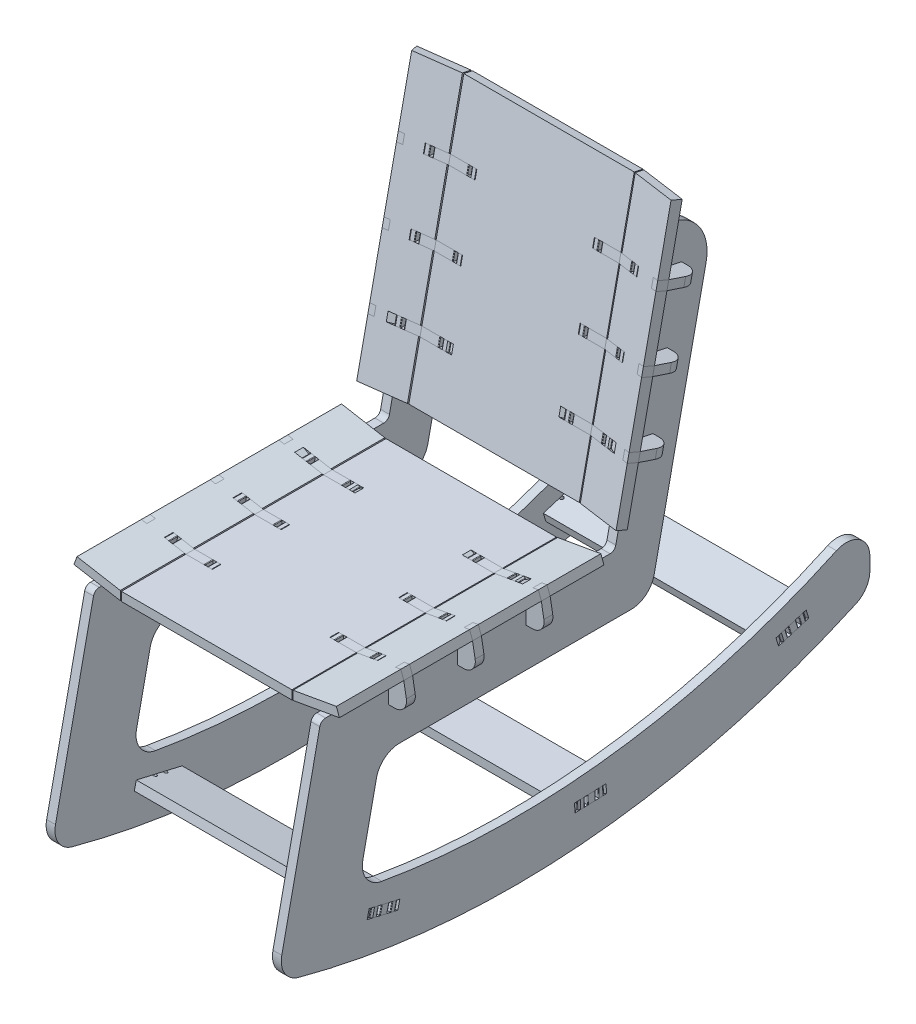
from build123d import *
from OCP.BRepFilletAPI import BRepFilletAPI_MakeChamfer

# Parameters (mm, degrees)
SKETCH1_W                      = 145
SKETCH1_H                      = 450
CENTRO_ASIENTO_DEPTH           = 15
LATERAL_ASIENTO_DEPTH          = 450
HUECO_START                    = -7.4
HUECO_JUNTA_OUTLINE_W          = 45
HUECO_JUNTA_OUTLINE_H          = 15
HUECO_JUNTA_DEPTH              = 14.8
BASE_START                     = -133.5
BASE_DE_ASIENTO_DEPTH          = 15
CHAMFER2_SIZE                  = 5
CHAMFER2_SIZE2                 = 8.660254038
CHAMFER3_SIZE                  = 5
CHAMFER3_SIZE2                 = 12.660444431
FILLET1_R                      = 20
PATRON_DE_HUECO_COUNT          = 3
PATRON_DE_HUECO_PITCH          = 117
PATRON_DE_BASES_COUNT          = 3
PATRON_DE_BASES_PITCH          = 117
SKETCH7_W                      = 14.8
SKETCH7_H                      = 15
HUECO_DE_JUNTA_DE_LATERA_DEPTH = 324.899019324
LATERAL_DEPTH                  = 15
BOSS_EXTRUDE8_DEPTH            = 185
BOSS_EXTRUDE9_DEPTH            = 15
CUT_EXTRUDE4_DEPTH             = 15
BOSS_EXTRUDE10_DEPTH           = 15
CUT_EXTRUDE5_DEPTH             = 15
CHAMFER4_SIZE                  = 5
CHAMFER4_SIZE2                 = 8.660254038
CIRPATTERN1_COUNT              = 3
CIRPATTERN1_ANGLE              = 30
CHAMFER4_OF_CIRPATTERN1_SIZE   = 5
CHAMFER4_OF_CIRPATTERN1_SIZE2  = 8.660254038
CIRPATTERN2_COUNT              = 3
CIRPATTERN2_ANGLE              = 30
MIRROR15_START                 = -427.113890753
MIRROR15_DEPTH                 = 14.96
MIRROR15_START_2               = -358.474090932
MIRROR15_2_DEPTH               = 14.96
MIRROR15_START_3               = -358.859222222
MIRROR15_3_DEPTH               = 14.96


# Read off the part's stored shape, not the designer's step: hueco junta, base de asiento, Mirror15
with BuildPart() as part:
    # Sketch1 → centro asiento (new body)
    with BuildSketch(Plane(origin=(0, 0, 0), x_dir=(1, 0, 0), z_dir=(0, 1, 0))):
        with Locations((72.5, 0)):
            Rectangle(SKETCH1_W, SKETCH1_H)
    extrude(amount=CENTRO_ASIENTO_DEPTH)


with BuildPart() as body_2:
    # Sketch2 → lateral asiento (new body)
    with BuildSketch(Plane.XY.offset(225)):
        Polygon((147, 0.352653961), (147, 15.352653961), (220.654318091, 28.339897487), (225.784620241, 14.244508175), align=None)
    extrude(amount=-LATERAL_ASIENTO_DEPTH)


with BuildPart() as hueco_junta_tool:
    # hueco junta outline → hueco junta (new body)
    with BuildSketch(Plane(origin=(0, 0, -126), x_dir=(-1, 0, 0), z_dir=(0, 0, -1)).offset(HUECO_START)):
        Polygon((-211.595504869, 11.742584302), (-211.595504869, 26.742584302), (-220.654318091, 28.339897487), (-225.784620241, 14.244508175), align=None)
        Polygon((-147, 15.352653961), (-181.468271355, 21.43034018), (-181.468271355, 6.43034018), (-147, 0.352653961), align=None)
        with Locations((-122.5, 7.5)):
            Rectangle(HUECO_JUNTA_OUTLINE_W, HUECO_JUNTA_OUTLINE_H)
    hueco_junta = extrude(amount=HUECO_JUNTA_DEPTH)


with BuildPart() as part_1:
    add(part.part)

    # hueco junta: cut by hueco_junta_tool
    add(hueco_junta_tool.part, mode=Mode.SUBTRACT)

    # Chamfer2
    chamfer2_edges = [part_1.edges().sort_by_distance(p)[0] for p in [
        (100, 15, -126),
    ]]
    chamfer2_side = [part_1.faces().sort_by_distance(p)[0] for p in [
        (100, 7.5, -126),
    ]]
    chamfer(chamfer2_edges, length=CHAMFER2_SIZE, length2=CHAMFER2_SIZE2, reference=chamfer2_side[0])


with BuildPart() as body_2_1:
    add(body_2.part)

    # hueco junta: cut by hueco_junta_tool
    add(hueco_junta_tool.part, mode=Mode.SUBTRACT)

    # Chamfer3
    chamfer3_edges = [body_2_1.edges().sort_by_distance(p)[0] for p in [
        (181.468271355, 21.43034018, -126),
    ]]
    chamfer3_side = [body_2_1.faces().sort_by_distance(p)[0] for p in [
        (181.468271355, 13.93034018, -126),
    ]]
    chamfer(chamfer3_edges, length=CHAMFER3_SIZE, length2=CHAMFER3_SIZE2, reference=chamfer3_side[0])


with BuildPart() as body_3:
    # base de asiento outline → base de asiento (new body)
    with BuildSketch(Plane.XY.offset(BASE_START)):
        with BuildLine():
            Line((167.325796529, 18.919386805), (167.258844549, 18.924834853))
            Line((167.258844549, 18.924834853), (145, 15))
            Line((145, 15), (114.5, 15))
            ThreePointArc((114.5, 15), (113.792893219, 14.707106781), (113.5, 14))
            Line((113.5, 14), (113.5, -2.304273175))
            ThreePointArc((113.5, -2.304273175), (110.75, -5.054273175), (108, -2.304273175))
            Line((108, -2.304273175), (108, 14))
            ThreePointArc((108, 14), (107.707106781, 14.707106781), (107, 15))
            Line((107, 15), (101, 15))
            Line((101, 15), (98.291144292, 13.138478673))
            ThreePointArc((98.291144292, 13.138478673), (97.858274182, 12.275088925), (98.357504319, 11.448295324))
            Line((98.357504319, 11.448295324), (100, 10.5))
            Line((100, 10.5), (100, 0))
            Line((100, 0), (0, 0))
            Line((0, 0), (0, -34.130131105))
            Line((0, -34.130131105), (234.314374328, -34.130131105))
            Line((234.314374328, -34.130131105), (225.784620241, 14.244508175))
            Line((225.784620241, 14.244508175), (220.654318091, 28.339897487))
            Line((220.654318091, 28.339897487), (211.595504869, 26.742584302))
            Line((211.595504869, 26.742584302), (211.595504869, 11.742584302))
            Line((211.595504869, 11.742584302), (181.468271355, 6.43034018))
            Line((181.468271355, 6.43034018), (181.468271355, 16.93034018))
            Line((181.468271355, 16.93034018), (183.110767037, 17.878635503))
            ThreePointArc((183.110767037, 17.878635503), (183.609997173, 18.705429105), (183.177127064, 19.568818853))
            Line((183.177127064, 19.568818853), (180.672465677, 21.290018167))
            Line((180.672465677, 21.290018167), (174.583259993, 20.216326914))
            ThreePointArc((174.583259993, 20.216326914), (173.937756127, 19.805095597), (173.772100418, 19.057870983))
            Line((173.772100418, 19.057870983), (176.604840036, 2.992606288))
            ThreePointArc((176.604840036, 2.992606288), (174.374151204, -0.193147522), (171.188397394, 2.037541311))
            Line((171.188397394, 2.037541311), (168.357190069, 18.09411594))
            ThreePointArc((168.357190069, 18.09411594), (167.997148557, 18.701283658), (167.325796529, 18.919386805))
        make_face()
    extrude(amount=BASE_DE_ASIENTO_DEPTH)

    # Fillet1
    fillet1_edges = [body_3.edges().sort_by_distance(p)[0] for p in [
        (234.314374328, -34.130131105, -126),
    ]]
    fillet(fillet1_edges, radius=FILLET1_R)

    # base de asiento mirror: body 3 across plane


with BuildPart() as body_3_1:
    add(body_3.part)
    add(body_3.part.mirror(Plane(origin=(0, 0, -118.5), x_dir=(0, 0, 1), z_dir=(1, 0, 0))))


with BuildPart() as patron_de_hueco_tool:
    # patron de hueco: hueco junta ×3
    with Locations(*[(0, 0, i * PATRON_DE_HUECO_PITCH) for i in range(1, PATRON_DE_HUECO_COUNT)]):
        add(hueco_junta)


with BuildPart() as part_2:
    add(part_1.part)

    # patron de hueco: cut by patron_de_hueco_tool
    add(patron_de_hueco_tool.part, mode=Mode.SUBTRACT)

    # Mirror8: part across plane


with BuildPart() as body_2_2:
    add(body_2_1.part)

    # patron de hueco: cut by patron_de_hueco_tool
    add(patron_de_hueco_tool.part, mode=Mode.SUBTRACT)


with BuildPart() as patron_de_bases_1:
    # patron de bases: pattern copy
    add(body_3_1.part.moved(Location(Vector(0, 0, 1) * (1 * PATRON_DE_BASES_PITCH))))


with BuildPart() as patron_de_bases_2:
    # patron de bases: pattern copy
    add(body_3_1.part.moved(Location(Vector(0, 0, 1) * (2 * PATRON_DE_BASES_PITCH))))


with BuildPart() as part_3:
    add(part_2.part)
    add(part_2.part.mirror(Plane(origin=(0, 15, 0), x_dir=(0, 0, 1), z_dir=(1, 0, 0))))


with BuildPart() as body_6:
    # lateral assiento mirror: mirrored copy
    add(body_2_2.part.mirror(Plane(origin=(0, 0, 0), x_dir=(0, 0, 1), z_dir=(1, 0, 0))))


with BuildPart() as hueco_de_junta_de_latera_tool:
    # Sketch7 → hueco de junta de latera (new, symmetric)
    with BuildSketch(Plane.XY):
        with Locations((192.6, -26.630131105)):
            Rectangle(SKETCH7_W, SKETCH7_H)
    hueco_de_junta_de_latera = extrude(amount=HUECO_DE_JUNTA_DE_LATERA_DEPTH, both=True)


with BuildPart() as body_3_2:
    add(body_3_1.part)

    # hueco de junta de latera: cut by hueco_de_junta_de_latera_tool
    add(hueco_de_junta_de_latera_tool.part, mode=Mode.SUBTRACT)


with BuildPart() as patron_de_bases_1_1:
    add(patron_de_bases_1.part)

    # hueco de junta de latera: cut by hueco_de_junta_de_latera_tool
    add(hueco_de_junta_de_latera_tool.part, mode=Mode.SUBTRACT)


with BuildPart() as patron_de_bases_2_1:
    add(patron_de_bases_2.part)

    # hueco de junta de latera: cut by hueco_de_junta_de_latera_tool
    add(hueco_de_junta_de_latera_tool.part, mode=Mode.SUBTRACT)


with BuildPart() as junta_de_lateral_mirror_tool:
    # junta de lateral mirror: hueco de junta de latera across plane
    add(hueco_de_junta_de_latera.mirror(Plane(origin=(0, 0, 0), x_dir=(0, 0, 1), z_dir=(1, 0, 0))))


with BuildPart() as body_3_3:
    add(body_3_2.part)

    # junta de lateral mirror: cut by junta_de_lateral_mirror_tool
    add(junta_de_lateral_mirror_tool.part, mode=Mode.SUBTRACT)


with BuildPart() as patron_de_bases_1_2:
    add(patron_de_bases_1_1.part)

    # junta de lateral mirror: cut by junta_de_lateral_mirror_tool
    add(junta_de_lateral_mirror_tool.part, mode=Mode.SUBTRACT)


with BuildPart() as patron_de_bases_2_2:
    add(patron_de_bases_2_1.part)

    # junta de lateral mirror: cut by junta_de_lateral_mirror_tool
    add(junta_de_lateral_mirror_tool.part, mode=Mode.SUBTRACT)


with BuildPart() as body_7:
    # espaldar mirror: mirrored copy
    add(part_3.part.mirror(Plane(origin=(0, 131.715277178, -162.654821259), x_dir=(0, 0.7771459614569677, 0.6293203910498414), z_dir=(0, -0.6293203910498414, 0.7771459614569677))))


with BuildPart() as body_8:
    # espaldar mirror 2: mirrored copy
    add(body_2_2.part.mirror(Plane(origin=(0, 131.715277178, -162.654821259), x_dir=(0, 0.7771459614569677, 0.6293203910498414), z_dir=(0, -0.6293203910498414, 0.7771459614569677))))


with BuildPart() as body_9:
    # espaldar mirror 3: mirrored copy
    add(body_3_3.part.mirror(Plane(origin=(0, 131.715277178, -162.654821259), x_dir=(0, 0.7771459614569677, 0.6293203910498414), z_dir=(0, -0.6293203910498414, 0.7771459614569677))))


with BuildPart() as body_10:
    # espaldar mirror 4: mirrored copy
    add(patron_de_bases_1_2.part.mirror(Plane(origin=(0, 131.715277178, -162.654821259), x_dir=(0, 0.7771459614569677, 0.6293203910498414), z_dir=(0, -0.6293203910498414, 0.7771459614569677))))


with BuildPart() as body_11:
    # espaldar mirror 5: mirrored copy
    add(patron_de_bases_2_2.part.mirror(Plane(origin=(0, 131.715277178, -162.654821259), x_dir=(0, 0.7771459614569677, 0.6293203910498414), z_dir=(0, -0.6293203910498414, 0.7771459614569677))))


with BuildPart() as body_12:
    # espaldar mirror 6: mirrored copy
    add(body_6.part.mirror(Plane(origin=(0, 131.715277178, -162.654821259), x_dir=(0, 0.7771459614569677, 0.6293203910498414), z_dir=(0, -0.6293203910498414, 0.7771459614569677))))


with BuildPart() as body_13:
    # Sketch9 → lateral (new body)
    with BuildSketch(Plane(origin=(200, 0, 0), x_dir=(0, 0, -1), z_dir=(1, 0, 0))):
        with BuildLine():
            Line((133.4, -0.2), (133.4, -19.130131105))
            Line((133.4, -19.130131105), (118.6, -19.130131105))
            Line((118.6, -19.130131105), (118.6, -0.2))
            Line((118.6, -0.2), (16.4, -0.2))
            Line((16.4, -0.2), (16.4, -19.130131105))
            Line((16.4, -19.130131105), (1.6, -19.130131105))
            Line((1.6, -19.130131105), (1.6, -0.2))
            Line((1.6, -0.2), (-100.5, -0.2))
            Line((-100.5, -0.2), (-100.5, -19.130131105))
            Line((-100.5, -19.130131105), (-115.5, -19.130131105))
            Line((-115.5, -19.130131105), (-115.5, -0.2))
            Line((-115.5, -0.2), (-222.7169222, -0.2))
            ThreePointArc((-222.7169222, -0.2), (-229.01012611, -2.428540385), (-232.498398207, -8.120883092))
            Line((-232.498398207, -8.120883092), (-297.208407351, -312.557540494))
            ThreePointArc((-297.208407351, -312.557540494), (-292.212377636, -341.734297658), (-268.525048202, -359.486872))
            ThreePointArc((-268.525048202, -359.486872), (212.21172433, -403.766433707), (679.650786777, -283.063298085))
            ThreePointArc((679.650786777, -283.063298085), (696.771873684, -268.304545688), (703.158778549, -246.621376283))
            Line((703.158778549, -246.621376283), (703.158778549, -224.635184402))
            ThreePointArc((703.158778549, -224.635184402), (684.728815484, -190.949378688), (646.422103218, -188.30498073))
            ThreePointArc((646.422103218, -188.30498073), (267.318131938, -297.45486779), (-127.087018515, -288.617663345))
            ThreePointArc((-127.087018515, -288.617663345), (-153.324093764, -271.600422628), (-159.297021384, -240.903603005))
            Line((-159.297021384, -240.903603005), (-136.124090017, -131.883532367))
            ThreePointArc((-136.124090017, -131.883532367), (-122.171001629, -109.114161542), (-96.998185987, -100.2))
            Line((-96.998185987, -100.2), (297.052935967, -100.2))
            ThreePointArc((297.052935967, -100.2), (322.225751609, -91.285838458), (336.178839996, -68.516467633))
            Line((336.178839996, -68.516467633), (424.586342239, 347.408129322))
            ThreePointArc((424.586342239, 347.408129322), (414.12556478, 403.84943376), (366.818648995, 436.362576188))
            Line((366.818648995, 436.362576188), (362.272858618, 437.328813761))
            Line((362.272858618, 437.328813761), (349.302651638, 376.30878748))
            Line((349.302651638, 376.30878748), (368.01474348, 372.331409576))
            Line((368.01474348, 372.331409576), (364.937650456, 357.854825086))
            Line((364.937650456, 357.854825086), (346.225558614, 361.832202989))
            Line((346.225558614, 361.832202989), (324.976983813, 261.865518194))
            Line((324.976983813, 261.865518194), (343.689075654, 257.888140291))
            Line((343.689075654, 257.888140291), (340.61198263, 243.4115558))
            Line((340.61198263, 243.4115558), (321.899890788, 247.388933703))
            Line((321.899890788, 247.388933703), (300.651315987, 147.422248908))
            Line((300.651315987, 147.422248908), (319.363407829, 143.444871005))
            Line((319.363407829, 143.444871005), (316.286314805, 128.968286514))
            Line((316.286314805, 128.968286514), (297.574222963, 132.945664417))
            Line((297.574222963, 132.945664417), (270.956874008, 7.720883092))
            ThreePointArc((270.956874008, 7.720883092), (267.468601911, 2.028540385), (261.175398001, -0.2))
            Line((261.175398001, -0.2), (133.4, -0.2))
        make_face()
    extrude(amount=-LATERAL_DEPTH)


with BuildPart() as body_14:
    # lateral 2: mirrored copy
    add(body_13.part.mirror(Plane(origin=(0, 0, 0), x_dir=(0, 0, 1), z_dir=(1, 0, 0))))

    # Sketch15 → Cut-Extrude5 (cut)
    with BuildSketch(Plane(origin=(-185, 0, 0), x_dir=(0, 0, -1), z_dir=(1, 0, 0))):
        Polygon((-140.181102848, -320.099438691), (-101.257166732, -329.139836757), (-104.641660101, -343.711960989), (-143.565596218, -334.671562923), align=None)
    cut_extrude5 = extrude(amount=-CUT_EXTRUDE5_DEPTH, mode=Mode.SUBTRACT)

    # Chamfer4: one chamfer whose edges measure the first distance from different faces: ONE call of the kernel's chamfer builder (chamfer() names one face for all edges)
    chamfer4_edges_1 = [body_14.edges().sort_by_distance(p)[0] for p in [
        (-200, -336.425898873, 102.949413417),
    ]]
    chamfer4_side_1 = [body_14.faces().sort_by_distance(p)[0] for p in [
        (-200, 232.58090146, -328.531101177),
    ]]
    chamfer4_edges_2 = [body_14.edges().sort_by_distance(p)[0] for p in [
        (-200, -327.385500807, 141.873349533),
    ]]
    chamfer4_side_2 = [body_14.faces().sort_by_distance(p)[0] for p in [
        (-192.5, -327.385500807, 141.873349533),
    ]]
    chamfer4 = BRepFilletAPI_MakeChamfer(body_14.part.solid().wrapped)
    for e in chamfer4_edges_1:
        chamfer4.Add(CHAMFER4_SIZE, CHAMFER4_SIZE2, e.wrapped, chamfer4_side_1[0].wrapped)  # the first distance lies on this face
    for e in chamfer4_edges_2:
        chamfer4.Add(CHAMFER4_SIZE, CHAMFER4_SIZE2, e.wrapped, chamfer4_side_2[0].wrapped)  # the first distance lies on this face
    add(Compound.cast(chamfer4.Shape()), mode=Mode.REPLACE)

    # CirPattern1: Cut-Extrude5 ×3 about axis
    cirpattern1_axis = Axis((0, 999.8, -99.083379214), (1, 0, 0))
    for i in range(1, CIRPATTERN1_COUNT):
        add(cut_extrude5.rotate(cirpattern1_axis, i * CIRPATTERN1_ANGLE / (CIRPATTERN1_COUNT - 1)), mode=Mode.SUBTRACT)

    # Chamfer4 of CirPattern1: one chamfer whose edges measure the first distance from different faces: ONE call of the kernel's chamfer builder (chamfer() names one face for all edges)
    chamfer4_of_cirpattern1_edges_1 = [body_14.edges().sort_by_distance(p)[0] for p in [
        (-200, -343.185039946, -249.775398243),
    ]]
    chamfer4_of_cirpattern1_side_1 = [body_14.faces().sort_by_distance(p)[0] for p in [
        (-200, 318.108698597, -519.283774109),
    ]]
    chamfer4_of_cirpattern1_edges_2 = [body_14.edges().sort_by_distance(p)[0] for p in [
        (-200, -344.526941952, -209.837935892),
    ]]
    chamfer4_of_cirpattern1_side_2 = [body_14.faces().sort_by_distance(p)[0] for p in [
        (-192.5, -344.526941952, -209.837935892),
    ]]
    chamfer4_of_cirpattern1_edges_3 = [body_14.edges().sort_by_distance(p)[0] for p in [
        (-200, -258.421969934, -592.230797835),
    ]]
    chamfer4_of_cirpattern1_side_3 = [body_14.faces().sort_by_distance(p)[0] for p in [
        (-200, 450.092631377, -681.400484544),
    ]]
    chamfer4_of_cirpattern1_edges_4 = [body_14.edges().sort_by_distance(p)[0] for p in [
        (-200, -270.054723607, -554.00148131),
    ]]
    chamfer4_of_cirpattern1_side_4 = [body_14.faces().sort_by_distance(p)[0] for p in [
        (-192.5, -270.054723607, -554.00148131),
    ]]
    chamfer4_of_cirpattern1 = BRepFilletAPI_MakeChamfer(body_14.part.solid().wrapped)
    for e in chamfer4_of_cirpattern1_edges_1:
        chamfer4_of_cirpattern1.Add(CHAMFER4_OF_CIRPATTERN1_SIZE, CHAMFER4_OF_CIRPATTERN1_SIZE2, e.wrapped, chamfer4_of_cirpattern1_side_1[0].wrapped)  # the first distance lies on this face
    for e in chamfer4_of_cirpattern1_edges_2:
        chamfer4_of_cirpattern1.Add(CHAMFER4_OF_CIRPATTERN1_SIZE, CHAMFER4_OF_CIRPATTERN1_SIZE2, e.wrapped, chamfer4_of_cirpattern1_side_2[0].wrapped)  # the first distance lies on this face
    for e in chamfer4_of_cirpattern1_edges_3:
        chamfer4_of_cirpattern1.Add(CHAMFER4_OF_CIRPATTERN1_SIZE, CHAMFER4_OF_CIRPATTERN1_SIZE2, e.wrapped, chamfer4_of_cirpattern1_side_3[0].wrapped)  # the first distance lies on this face
    for e in chamfer4_of_cirpattern1_edges_4:
        chamfer4_of_cirpattern1.Add(CHAMFER4_OF_CIRPATTERN1_SIZE, CHAMFER4_OF_CIRPATTERN1_SIZE2, e.wrapped, chamfer4_of_cirpattern1_side_4[0].wrapped)  # the first distance lies on this face
    add(Compound.cast(chamfer4_of_cirpattern1.Shape()), mode=Mode.REPLACE)


with BuildPart() as body_15:
    # Sketch11 → Boss-Extrude8 (new body)
    with BuildSketch(Plane(origin=(0, 0, 0), x_dir=(0, 0, -1), z_dir=(1, 0, 0))):
        Polygon((-163.071051899, -330.161795892), (-85.145253868, -348.260690919), (-81.75171105, -333.649603788), (-159.677509082, -315.550708762), align=None)
    extrude(amount=-BOSS_EXTRUDE8_DEPTH)

    # Sketch12 → Boss-Extrude9 (add)
    with BuildSketch(Plane.ZY.offset(185)):
        Polygon((140.196059574, -320.075432518), (101.233160558, -329.124880032), (104.626703376, -343.735967162), (143.589602391, -334.686519649), align=None)
    extrude(amount=BOSS_EXTRUDE9_DEPTH)

    # Sketch13 → Cut-Extrude4 (cut)
    with BuildSketch(Plane(origin=(0, -349.199226567, 81.104336493), x_dir=(1, 0, 0), z_dir=(0, -0.9740724753912704, 0.22623618783281133))):
        with BuildLine():
            Line((-188, 32.151587506), (-188, 37.648477117))
            Line((-188, 37.648477117), (-199, 37.648477117))
            ThreePointArc((-199, 37.648477117), (-199.707106781, 37.941370336), (-200, 38.648477117))
            Line((-200, 38.648477117), (-200, 31.151587506))
            ThreePointArc((-200, 31.151587506), (-199.707106781, 31.858694287), (-199, 32.151587506))
            Line((-199, 32.151587506), (-188, 32.151587506))
        make_face()
        with BuildLine():
            Line((-182.695726825, 56.145366729), (-188, 56.145366729))
            Line((-188, 56.145366729), (-188, 50.648477117))
            Line((-188, 50.648477117), (-182.695726825, 50.648477117))
            ThreePointArc((-182.695726825, 50.648477117), (-179.853254403, 53.396921923), (-182.695726825, 56.145366729))
        make_face()
        with BuildLine():
            Line((-188, 50.648477117), (-188, 56.145366729))
            Line((-188, 56.145366729), (-199, 56.145366729))
            ThreePointArc((-199, 56.145366729), (-199.707106781, 56.438259948), (-200, 57.145366729))
            Line((-200, 57.145366729), (-200, 49.648477117))
            ThreePointArc((-200, 49.648477117), (-199.707106781, 50.355583899), (-199, 50.648477117))
            Line((-199, 50.648477117), (-188, 50.648477117))
        make_face()
        Polygon((-199.312801593, 24.148477117), (-200, 25.148477117), (-200, 24.148477117), align=None)
        Polygon((-200, 63.148477117), (-199.312801593, 64.148477117), (-200, 64.148477117), align=None)
        with BuildLine():
            Line((-182.695726825, 37.648477117), (-188, 37.648477117))
            Line((-188, 37.648477117), (-188, 32.151587506))
            Line((-188, 32.151587506), (-182.695726825, 32.151587506))
            ThreePointArc((-182.695726825, 32.151587506), (-179.853254403, 34.900032311), (-182.695726825, 37.648477117))
        make_face()
    extrude(amount=-CUT_EXTRUDE4_DEPTH, mode=Mode.SUBTRACT)

    # Sketch13<3> → Boss-Extrude10 (add)
    with BuildSketch(Plane(origin=(0, -349.199226567, 81.104336493), x_dir=(1, 0, 0), z_dir=(0, -0.9740724753912704, 0.22623618783281133))):
        with BuildLine():
            Line((-199.312801593, 64.148477117), (-195.5, 64.148477117))
            Line((-195.5, 64.148477117), (-196.448295324, 65.790972799))
            ThreePointArc((-196.448295324, 65.790972799), (-197.275088925, 66.290202935), (-198.138478673, 65.857332826))
            Line((-198.138478673, 65.857332826), (-199.312801593, 64.148477117))
        make_face()
        with BuildLine():
            Line((-196.448295324, 22.505981436), (-195.5, 24.148477117))
            Line((-195.5, 24.148477117), (-199.312801593, 24.148477117))
            Line((-199.312801593, 24.148477117), (-198.138478673, 22.439621409))
            ThreePointArc((-198.138478673, 22.439621409), (-197.275088925, 22.0067513), (-196.448295324, 22.505981436))
        make_face()
    extrude(amount=-BOSS_EXTRUDE10_DEPTH)

    # Mirror9: body 15 across plane


with BuildPart() as body_15_1:
    add(body_15.part)
    add(body_15.part.mirror(Plane.ZY))


with BuildPart() as cirpattern2_1:
    # CirPattern2: pattern copy
    add(body_15_1.part.rotate(Axis((0, 999.8, -99.083379214), (1, 0, 0)), 1 * CIRPATTERN2_ANGLE / (CIRPATTERN2_COUNT - 1)))


with BuildPart() as cirpattern2_2:
    # CirPattern2: pattern copy
    add(body_15_1.part.rotate(Axis((0, 999.8, -99.083379214), (1, 0, 0)), 2 * CIRPATTERN2_ANGLE / (CIRPATTERN2_COUNT - 1)))


with BuildPart() as body_13_1:
    add(body_13.part)

    # Mirror15 outline → Mirror15 (cut)
    with BuildSketch(Plane(origin=(0, 0, 0), x_dir=(1, 0, 0), z_dir=(0, 0.956689602732438, 0.291109951777074)).offset(MIRROR15_START)):
        Polygon((185, 491.351839501), (185, 451.391839501), (195, 451.391839501), (200, 442.731585463), (200, 496.351839501), (191.339745962, 491.351839501), align=None)
    extrude(amount=MIRROR15_DEPTH, mode=Mode.SUBTRACT)

    # Mirror15 2 outline → Mirror15 2 (cut)
    with BuildSketch(Plane(origin=(0, 0, 0), x_dir=(1, 0, 0), z_dir=(0, 0.9740724753912704, -0.2262361878328111)).offset(MIRROR15_START_2)):
        Polygon((200, -72.788731155), (200, -19.168477117), (191.339745962, -24.168477117), (185, -24.168477117), (185, -64.128477117), (195, -64.128477117), align=None)
    extrude(amount=MIRROR15_2_DEPTH, mode=Mode.SUBTRACT)

    # Mirror15 3 outline → Mirror15 3 (cut)
    with BuildSketch(Plane(origin=(0, 0, 0), x_dir=(1, 0, 0), z_dir=(0, 0.9994359947602738, 0.03358113127252079)).offset(MIRROR15_START_3)):
        Polygon((185, 238.109981732), (185, 198.149981732), (195, 198.149981732), (200, 189.489727694), (200, 243.109981732), (191.339745962, 238.109981732), align=None)
    extrude(amount=MIRROR15_3_DEPTH, mode=Mode.SUBTRACT)


solid = Compound([body_2_2.part, part_3.part, body_6.part, body_3_3.part, patron_de_bases_1_2.part, patron_de_bases_2_2.part, body_7.part, body_8.part, body_9.part, body_10.part, body_11.part, body_12.part, body_14.part, body_15_1.part, cirpattern2_1.part, cirpattern2_2.part, body_13_1.part])
